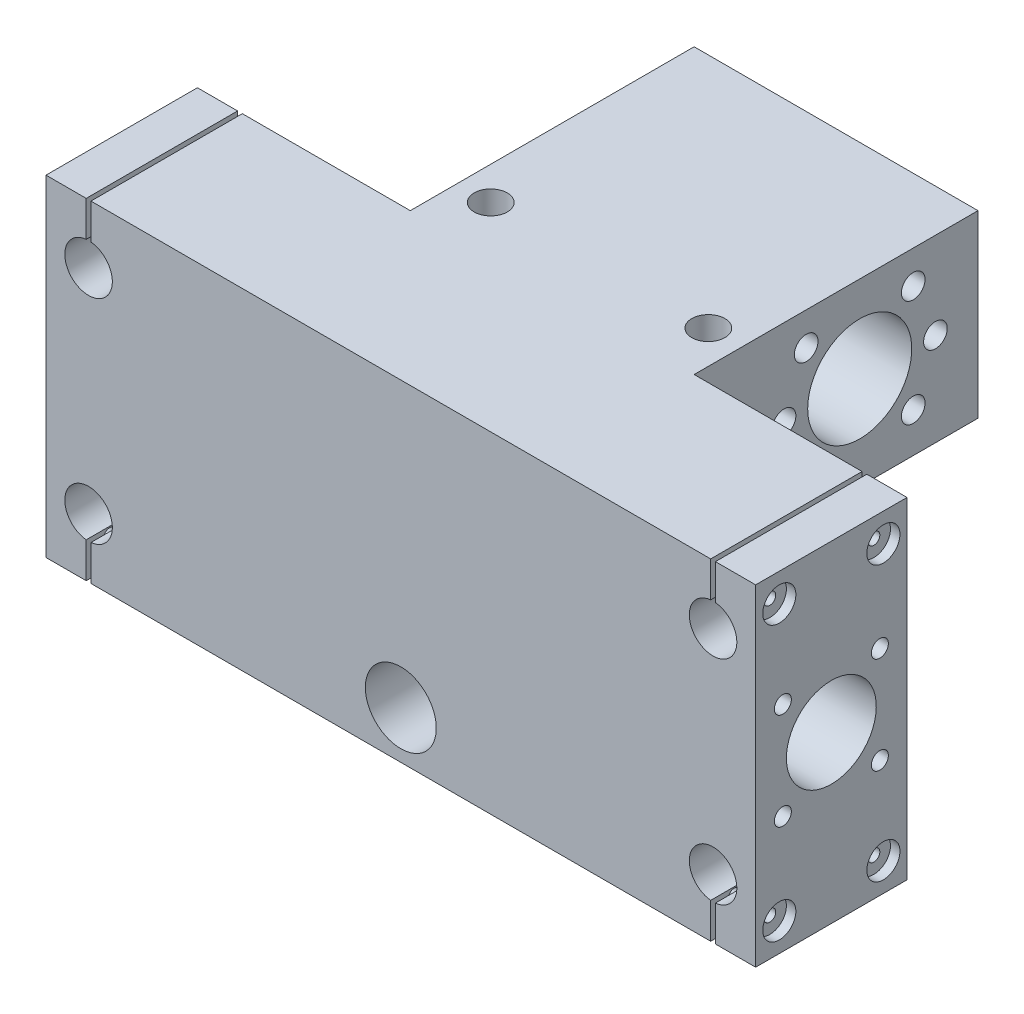
from build123d import *

# Parameters (mm, degrees)
SKETCH1_W                      = 150
SKETCH1_H                      = 70
BOSS_EXTRUDE1_DEPTH            = 32
SKETCH2_R                      = 9.5
LINEAR_BEARING_CUT_1_DEPTH     = 55
Y_AXIS_SHAFTS_CUT_DEPTH        = 169.594187326
LINEAR_BEARING_CUT_2_START     = -55
SKETCH7_R                      = 9.5
LINEAR_BEARING_CUT_2_DEPTH     = 55
SKETCH6_R                      = 6
BETWEEN_BEARINGS_DEPTH         = 123.266103234
SKETCH8_R                      = 3.5
SHAFT_HOLDER_SCREW_CUT_DEPTH   = 4
SKETCH9_R                      = 1.25
SHAFT_HOLDER_SCREW_CUT2_DEPTH  = 20
SHAFT_HOLDER_SCREW_CUT_3_START = -2
SKETCH10_R                     = 3.5
SHAFT_HOLDER_SCREW_CUT_3_DEPTH = 2
SHAFT_HOLDER_SCREW_CUT_4_START = -20
SKETCH11_R                     = 1.25
SHAFT_HOLDER_SCREW_CUT_4_DEPTH = 20
SKETCH12_R                     = 1.8
LINEAR_BEARING_SREW1_DEPTH     = 14
SKETCH13_R                     = 1.85
LINEAR_BEARING_SCREW2_DEPTH    = 14
SKETCH14_R                     = 7.5
CUT_EXTRUDE1_DEPTH             = 169.594187326
SKETCH15_W                     = 60
SKETCH15_H                     = 38
BOSS_EXTRUDE2_DEPTH            = 60
CUT_EXTRUDE2_REACH             = 141.732
SKETCH16_R                     = 11
SKETCH16_R_2                   = 2.5
CUT_EXTRUDE3_REACH             = 167.964
SKETCH17_R                     = 3.5


with BuildPart() as part:
    # Sketch1 → Boss-Extrude1 (new body)
    with BuildSketch(Plane.XY):
        with Locations((-75, -35)):
            Rectangle(SKETCH1_W, SKETCH1_H)
    extrude(amount=BOSS_EXTRUDE1_DEPTH)

    # Sketch2 → Linear_bearing-cut-1 (cut)
    with BuildSketch(Plane.ZY.offset(150)):
        with Locations((16, -35)):
            Circle(SKETCH2_R)
    extrude(amount=-LINEAR_BEARING_CUT_1_DEPTH, mode=Mode.SUBTRACT)

    # Sketch5 → Y-axis-shafts-cut (cut, through all)
    with BuildSketch(Plane.XY.offset(32)):
        with BuildLine():
            Line((-141.5, 0), (-141.5, -7.5))
            ThreePointArc((-141.5, -7.5), (-141, -17.524937811), (-140.5, -7.5))
            Line((-140.5, -7.5), (-140.5, 0))
            Line((-140.5, 0), (-141.5, 0))
        make_face()
        with BuildLine():
            Line((-8.5, 0), (-8.5, -7.5))
            ThreePointArc((-8.5, -7.5), (-9, -17.524937811), (-9.5, -7.5))
            Line((-9.5, -7.5), (-9.5, 0))
            Line((-9.5, 0), (-8.5, 0))
        make_face()
        with BuildLine():
            Line((-141.5, -70), (-141.5, -62.5))
            ThreePointArc((-141.5, -62.5), (-141, -52.475062189), (-140.5, -62.5))
            Line((-140.5, -62.5), (-140.5, -70))
            Line((-140.5, -70), (-141.5, -70))
        make_face()
        with BuildLine():
            Line((-9.5, -70), (-9.5, -62.5))
            ThreePointArc((-9.5, -62.5), (-9, -52.475062189), (-8.5, -62.5))
            Line((-8.5, -62.5), (-8.5, -70))
            Line((-8.5, -70), (-9.5, -70))
        make_face()
    extrude(amount=-Y_AXIS_SHAFTS_CUT_DEPTH, mode=Mode.SUBTRACT)

    # Sketch7 → Linear-bearing-cut-2 (cut)
    with BuildSketch(Plane(origin=(0, 0, 0), x_dir=(0, 0, -1), z_dir=(1, 0, 0)).offset(LINEAR_BEARING_CUT_2_START)):
        with Locations((-16, -35)):
            Circle(SKETCH7_R)
    extrude(amount=LINEAR_BEARING_CUT_2_DEPTH, mode=Mode.SUBTRACT)

    # Sketch6 → between-bearings (cut, through all)
    with BuildSketch(Plane.ZY.offset(95)):
        with Locations((16, -35)):
            Circle(SKETCH6_R)
    extrude(amount=-BETWEEN_BEARINGS_DEPTH, mode=Mode.SUBTRACT)

    # Sketch8 → shaft-holder-screw-cut (cut)
    with BuildSketch(Plane.ZY.offset(150)):
        with Locations((5, -6)):
            Circle(SKETCH8_R)
        with Locations((27, -6)):
            Circle(SKETCH8_R)
        with Locations((27, -64)):
            Circle(SKETCH8_R)
        with Locations((5, -64)):
            Circle(SKETCH8_R)
    extrude(amount=-SHAFT_HOLDER_SCREW_CUT_DEPTH, mode=Mode.SUBTRACT)

    # Sketch9 → shaft-holder-screw-cut2 (cut)
    with BuildSketch(Plane.ZY.offset(146)):
        with Locations((5, -6)):
            Circle(SKETCH9_R)
        with Locations((27, -6)):
            Circle(SKETCH9_R)
        with Locations((5, -64)):
            Circle(SKETCH9_R)
        with Locations((27, -64)):
            Circle(SKETCH9_R)
    extrude(amount=-SHAFT_HOLDER_SCREW_CUT2_DEPTH, mode=Mode.SUBTRACT)

    # Sketch10 → shaft-holder-screw-cut-3 (cut)
    with BuildSketch(Plane(origin=(0, 0, 0), x_dir=(0, 0, -1), z_dir=(1, 0, 0)).offset(SHAFT_HOLDER_SCREW_CUT_3_START)):
        with Locations((-27, -6)):
            Circle(SKETCH10_R)
        with Locations((-5, -6)):
            Circle(SKETCH10_R)
        with Locations((-5, -64)):
            Circle(SKETCH10_R)
        with Locations((-27, -64)):
            Circle(SKETCH10_R)
    extrude(amount=SHAFT_HOLDER_SCREW_CUT_3_DEPTH, mode=Mode.SUBTRACT)

    # Sketch11 → shaft-holder-screw-cut-4 (cut)
    with BuildSketch(Plane(origin=(-2, 0, 0), x_dir=(0, 0, -1), z_dir=(1, 0, 0)).offset(SHAFT_HOLDER_SCREW_CUT_4_START)):
        with Locations((-27, -6)):
            Circle(SKETCH11_R)
        with Locations((-5, -6)):
            Circle(SKETCH11_R)
        with Locations((-5, -64)):
            Circle(SKETCH11_R)
        with Locations((-27, -64)):
            Circle(SKETCH11_R)
    extrude(amount=SHAFT_HOLDER_SCREW_CUT_4_DEPTH, mode=Mode.SUBTRACT)

    # Sketch12 → Linear-bearing-srew1 (cut)
    with BuildSketch(Plane(origin=(0, 0, 0), x_dir=(0, 0, -1), z_dir=(1, 0, 0))):
        with Locations((-5.75, -24.75)):
            Circle(SKETCH12_R)
        with Locations((-26.25, -24.75)):
            Circle(SKETCH12_R)
        with Locations((-5.75, -45.25)):
            Circle(SKETCH12_R)
        with Locations((-26.25, -45.25)):
            Circle(SKETCH12_R)
    extrude(amount=-LINEAR_BEARING_SREW1_DEPTH, mode=Mode.SUBTRACT)

    # Sketch13 → Linear-bearing-screw2 (cut)
    with BuildSketch(Plane.ZY.offset(150)):
        with Locations((27.5, -24.75)):
            Circle(SKETCH13_R)
        with Locations((4.5, -24.75)):
            Circle(SKETCH13_R)
        with Locations((27.5, -45.25)):
            Circle(SKETCH13_R)
        with Locations((4.5, -45.25)):
            Circle(SKETCH13_R)
    extrude(amount=-LINEAR_BEARING_SCREW2_DEPTH, mode=Mode.SUBTRACT)

    # Sketch14 → Cut-Extrude1 (cut, through all)
    with BuildSketch(Plane(origin=(0, 0, 0), x_dir=(-1, 0, 0), z_dir=(0, 0, -1))):
        with Locations((75, -60)):
            Circle(SKETCH14_R)
    extrude(amount=-CUT_EXTRUDE1_DEPTH, mode=Mode.SUBTRACT)

    # Sketch15 → Boss-Extrude2 (add)
    with BuildSketch(Plane(origin=(0, 0, 0), x_dir=(-1, 0, 0), z_dir=(0, 0, -1))):
        with Locations((75, -19)):
            Rectangle(SKETCH15_W, SKETCH15_H)
    extrude(amount=BOSS_EXTRUDE2_DEPTH)

    # Sketch16 → Cut-Extrude2 (cut, up to next)
    with BuildSketch(Plane.ZY.offset(105), mode=Mode.PRIVATE) as cut_extrude2_sk1:
        with Locations((-35, -18.29)):
            Circle(SKETCH16_R)
    cut_extrude2_tool1 = extrude(cut_extrude2_sk1.sketch, amount=-CUT_EXTRUDE2_REACH, mode=Mode.PRIVATE) & part.part
    # Sketch16 → Cut-Extrude2 (cut, up to next)
    with BuildSketch(Plane.ZY.offset(105), mode=Mode.PRIVATE) as cut_extrude2_sk2:
        with Locations((-46.313708499, -29.603708499)):
            Circle(SKETCH16_R_2)
    cut_extrude2_tool2 = extrude(cut_extrude2_sk2.sketch, amount=-CUT_EXTRUDE2_REACH, mode=Mode.PRIVATE) & part.part
    # Sketch16 → Cut-Extrude2 (cut, up to next)
    with BuildSketch(Plane.ZY.offset(105), mode=Mode.PRIVATE) as cut_extrude2_sk3:
        with Locations((-51, -18.29)):
            Circle(SKETCH16_R_2)
    cut_extrude2_tool3 = extrude(cut_extrude2_sk3.sketch, amount=-CUT_EXTRUDE2_REACH, mode=Mode.PRIVATE) & part.part
    # Sketch16 → Cut-Extrude2 (cut, up to next)
    with BuildSketch(Plane.ZY.offset(105), mode=Mode.PRIVATE) as cut_extrude2_sk4:
        with Locations((-19, -18.29)):
            Circle(SKETCH16_R_2)
    cut_extrude2_tool4 = extrude(cut_extrude2_sk4.sketch, amount=-CUT_EXTRUDE2_REACH, mode=Mode.PRIVATE) & part.part
    # Sketch16 → Cut-Extrude2 (cut, up to next)
    with BuildSketch(Plane.ZY.offset(105), mode=Mode.PRIVATE) as cut_extrude2_sk5:
        with Locations((-23.686291501, -29.603708499)):
            Circle(SKETCH16_R_2)
    cut_extrude2_tool5 = extrude(cut_extrude2_sk5.sketch, amount=-CUT_EXTRUDE2_REACH, mode=Mode.PRIVATE) & part.part
    # Sketch16 → Cut-Extrude2 (cut, up to next)
    with BuildSketch(Plane.ZY.offset(105), mode=Mode.PRIVATE) as cut_extrude2_sk6:
        with Locations((-23.686291501, -6.976291501)):
            Circle(SKETCH16_R_2)
    cut_extrude2_tool6 = extrude(cut_extrude2_sk6.sketch, amount=-CUT_EXTRUDE2_REACH, mode=Mode.PRIVATE) & part.part
    # Sketch16 → Cut-Extrude2 (cut, up to next)
    with BuildSketch(Plane.ZY.offset(105), mode=Mode.PRIVATE) as cut_extrude2_sk7:
        with Locations((-46.313708499, -6.976291501)):
            Circle(SKETCH16_R_2)
    cut_extrude2_tool7 = extrude(cut_extrude2_sk7.sketch, amount=-CUT_EXTRUDE2_REACH, mode=Mode.PRIVATE) & part.part
    add(cut_extrude2_tool1.solids().sort_by_distance((-105, -18.29, -35))[0], mode=Mode.SUBTRACT)
    add(cut_extrude2_tool2.solids().sort_by_distance((-105, -29.603708, -46.313708))[0], mode=Mode.SUBTRACT)
    add(cut_extrude2_tool3.solids().sort_by_distance((-105, -18.29, -51))[0], mode=Mode.SUBTRACT)
    add(cut_extrude2_tool4.solids().sort_by_distance((-105, -18.29, -19))[0], mode=Mode.SUBTRACT)
    add(cut_extrude2_tool5.solids().sort_by_distance((-105, -29.603708, -23.686292))[0], mode=Mode.SUBTRACT)
    add(cut_extrude2_tool6.solids().sort_by_distance((-105, -6.976292, -23.686292))[0], mode=Mode.SUBTRACT)
    add(cut_extrude2_tool7.solids().sort_by_distance((-105, -6.976292, -46.313708))[0], mode=Mode.SUBTRACT)

    # Sketch17 → Cut-Extrude3 (cut, up to next)
    with BuildSketch(Plane.XZ.offset(38), mode=Mode.PRIVATE) as cut_extrude3_sk1:
        with Locations((-98, -10)):
            Circle(SKETCH17_R)
    cut_extrude3_tool1 = extrude(cut_extrude3_sk1.sketch, amount=-CUT_EXTRUDE3_REACH, mode=Mode.PRIVATE) & part.part
    # Sketch17 → Cut-Extrude3 (cut, up to next)
    with BuildSketch(Plane.XZ.offset(38), mode=Mode.PRIVATE) as cut_extrude3_sk2:
        with Locations((-52, -10)):
            Circle(SKETCH17_R)
    cut_extrude3_tool2 = extrude(cut_extrude3_sk2.sketch, amount=-CUT_EXTRUDE3_REACH, mode=Mode.PRIVATE) & part.part
    add(cut_extrude3_tool1.solids().sort_by_distance((-98, -38, -10))[0], mode=Mode.SUBTRACT)
    add(cut_extrude3_tool2.solids().sort_by_distance((-52, -38, -10))[0], mode=Mode.SUBTRACT)


solid = part.part
